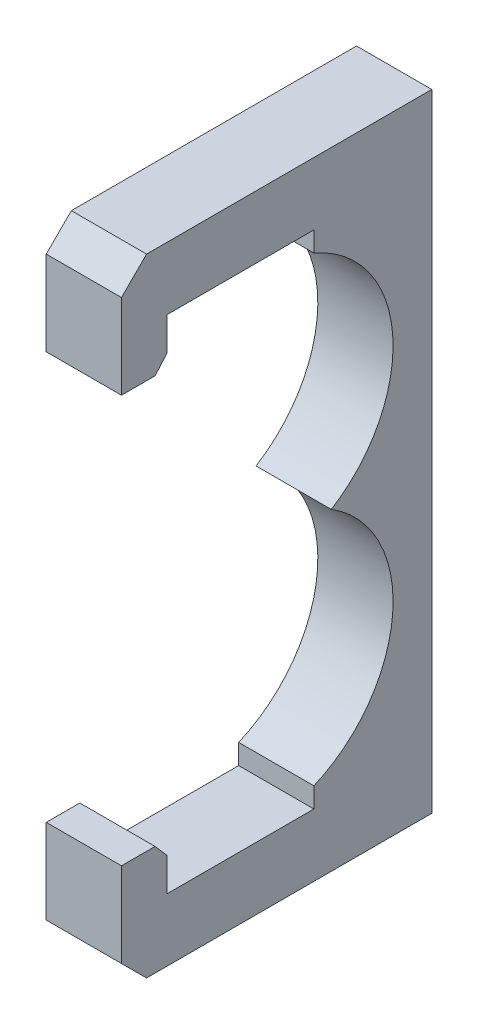
from build123d import *

# Parameters (mm, degrees)
BOSS_EXTRUDE1_DEPTH = 6
SKETCH4_R           = 1.25
CUT_EXTRUDE1_DEPTH  = 6


with BuildPart() as part:
    # Sketch1 → Boss-Extrude1 (new body)
    with BuildSketch(Plane(origin=(0, 0, 0), x_dir=(0, 0, -1), z_dir=(1, 0, 0))):
        with BuildLine():
            Line((41.203205101, 15.688911622), (43.203205101, 17.688911622))
            Line((43.203205101, 17.688911622), (65.948748697, 17.688911622))
            Line((65.948748697, 17.688911622), (65.948748697, -32.311088378))
            Line((65.948748697, -32.311088378), (43.203205101, -32.311088378))
            Line((43.203205101, -32.311088378), (41.203205101, -30.311088378))
            Line((41.203205101, -30.311088378), (41.203205101, -23.561088378))
            Line((41.203205101, -23.561088378), (43.880106331, -23.561088378))
            Line((43.880106331, -23.561088378), (44.81485523, -24.633587377))
            Line((44.81485523, -24.633587377), (44.81485523, -27.311088378))
            Line((44.81485523, -27.311088378), (56.547992273, -27.311088378))
            Line((56.547992273, -27.311088378), (56.547992273, -25.708962028))
            ThreePointArc((56.547992273, -25.708962028), (62.834374894, -16.931491254), (57.934329164, -7.311088378))
            ThreePointArc((57.934329164, -7.311088378), (62.834374894, 2.309314498), (56.547992273, 11.086785272))
            Line((56.547992273, 11.086785272), (56.547992273, 12.688911622))
            Line((56.547992273, 12.688911622), (44.81485523, 12.688911622))
            Line((44.81485523, 12.688911622), (44.81485523, 10.011410621))
            Line((44.81485523, 10.011410621), (43.880106331, 8.938911622))
            Line((43.880106331, 8.938911622), (41.203205101, 8.938911622))
            Line((41.203205101, 8.938911622), (41.203205101, 15.688911622))
        make_face()
    extrude(amount=BOSS_EXTRUDE1_DEPTH)

    # Sketch4 → Cut-Extrude1 (cut)
    with BuildSketch(Plane(origin=(0, 0, -65.948748697), x_dir=(-1, 0, 0), z_dir=(0, 0, -1))):
        with Locations((-3, 15.188911622)):
            Circle(SKETCH4_R)
        with Locations((-3, -29.622535768)):
            Circle(SKETCH4_R)
    extrude(amount=-CUT_EXTRUDE1_DEPTH, mode=Mode.SUBTRACT)


solid = part.part
